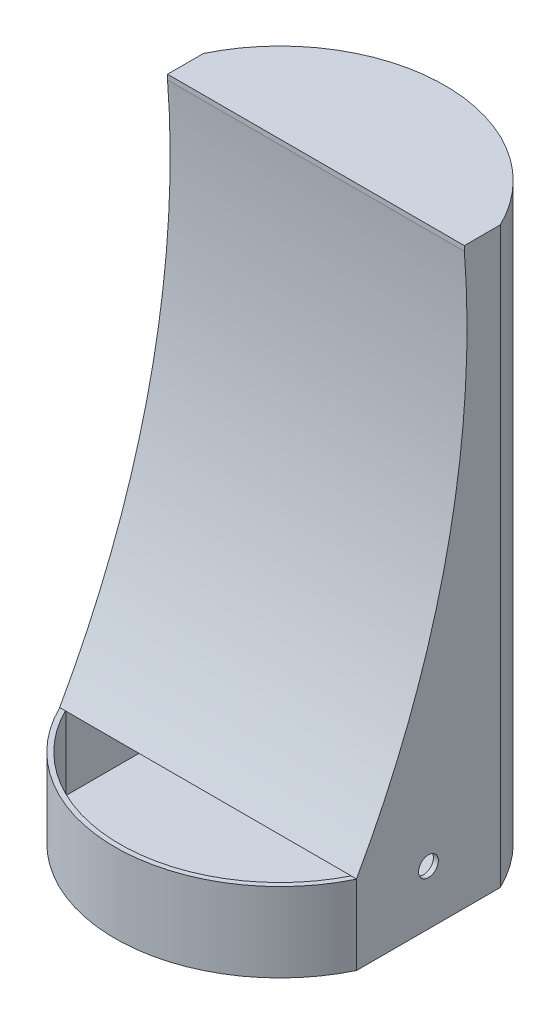
from build123d import *

# Parameters (mm, degrees)
SKETCH1_R            = 100
BOSS_EXTRUDE2_DEPTH  = 3
SKETCH5_W            = 3
SKETCH5_H            = 87
BOSS_EXTRUDE5_DEPTH  = 45
SKETCH8_W            = 3
SKETCH8_H            = 87
BOSS_EXTRUDE6_DEPTH  = 45
SKETCH9_W            = 23.719660605
SKETCH9_H            = 94.301811056
CUT_EXTRUDE2_DEPTH   = 45
SKETCH10_W           = 23.969699351
SKETCH10_H           = 92.447375273
CUT_EXTRUDE3_DEPTH   = 45
SKETCH11_R           = 6
CUT_EXTRUDE4_DEPTH   = 45
CUT_EXTRUDE5_START   = -45
SKETCH12_R           = 6
CUT_EXTRUDE5_DEPTH   = 45
BOSS_EXTRUDE7_DEPTH  = 45
CUT_EXTRUDE6_DEPTH   = 45
BOSS_EXTRUDE8_DEPTH  = 3
BOSS_EXTRUDE10_DEPTH = 3
SWEEP1_START         = 48
SWEEP1_DEPTH         = 300
BOSS_EXTRUDE11_START = -3
BOSS_EXTRUDE11_DEPTH = 3
SWEEP2_START         = -90
SWEEP2_DEPTH         = 180


# Read off the part's stored shape, not the designer's step: Sweep1, Sweep2
with BuildPart() as part:
    # Sketch1 → Boss-Extrude2 (new body)
    with BuildSketch(Plane(origin=(0, 0, 0), x_dir=(1, 0, 0), z_dir=(0, 1, 0))):
        with Locations(Location((0, 0, 0), (0, 0, 270))):
            Circle(SKETCH1_R)
    extrude(amount=BOSS_EXTRUDE2_DEPTH)

    # Sketch5 → Boss-Extrude5 (add)
    with BuildSketch(Plane(origin=(0, 3, 0), x_dir=(1, 0, 0), z_dir=(0, 1, 0))):
        with Locations((88.5, 0.088989435)):
            Rectangle(SKETCH5_W, SKETCH5_H)
    extrude(amount=BOSS_EXTRUDE5_DEPTH)

    # Sketch8 → Boss-Extrude6 (add)
    with BuildSketch(Plane(origin=(0, 3, 0), x_dir=(1, 0, 0), z_dir=(0, 1, 0))):
        with Locations((-88.5, 0.088989435)):
            Rectangle(SKETCH8_W, SKETCH8_H)
    extrude(amount=BOSS_EXTRUDE6_DEPTH)

    # Sketch9 → Cut-Extrude2 (cut)
    with BuildSketch(Plane(origin=(0, 3, 0), x_dir=(1, 0, 0), z_dir=(0, 1, 0))):
        with Locations((101.859830303, -3.561916093)):
            Rectangle(SKETCH9_W, SKETCH9_H)
    extrude(amount=-CUT_EXTRUDE2_DEPTH, mode=Mode.SUBTRACT)

    # Sketch10 → Cut-Extrude3 (cut)
    with BuildSketch(Plane(origin=(0, 3, 0), x_dir=(1, 0, 0), z_dir=(0, 1, 0))):
        with Locations((-101.984849676, 2.812677071)):
            Rectangle(SKETCH10_W, SKETCH10_H)
    extrude(amount=-CUT_EXTRUDE3_DEPTH, mode=Mode.SUBTRACT)

    # Sketch11 → Cut-Extrude4 (cut)
    with BuildSketch(Plane.ZY.offset(90)):
        with Locations((0, 33)):
            Circle(SKETCH11_R)
    extrude(amount=-CUT_EXTRUDE4_DEPTH, mode=Mode.SUBTRACT)

    # Sketch12 → Cut-Extrude5 (cut)
    with BuildSketch(Plane(origin=(90, 0, 0), x_dir=(0, 0, -1), z_dir=(1, 0, 0)).offset(CUT_EXTRUDE5_START)):
        with Locations(Location((0, 33, 0), (0, 0, 180))):
            Circle(SKETCH12_R)
    extrude(amount=CUT_EXTRUDE5_DEPTH, mode=Mode.SUBTRACT)

    # Sketch14 → Boss-Extrude7 (add)
    with BuildSketch(Plane(origin=(0, 3, 0), x_dir=(1, 0, 0), z_dir=(0, 1, 0))):
        with BuildLine():
            Line((-90, -43.411010565), (-90.085982049, -43.411010565))
            ThreePointArc((-90.085982049, -43.411010565), (-0.098829893, -99.999951163), (90, -43.588989435))
            Line((90, -43.588989435), (90, -43.411010565))
            Line((90, -43.411010565), (87, -43.411010565))
            Line((87, -43.411010565), (87, 43.588989435))
            Line((87, 43.588989435), (90, 43.588989435))
            ThreePointArc((90, 43.588989435), (0, 100), (-90, 43.588989435))
            Line((-90, 43.588989435), (-87, 43.588989435))
            Line((-87, 43.588989435), (-87, -43.411010565))
            Line((-87, -43.411010565), (-90, -43.411010565))
        make_face()
    extrude(amount=BOSS_EXTRUDE7_DEPTH)

    # 3DSketch1 → Cut-Extrude6 (cut)
    with BuildSketch(Plane(origin=(-87, 48, -42.895221179), x_dir=(0.8969072164948455, 0, 0.4422187750417981), z_dir=(0, -1, 0))):
        with BuildLine():
            Line((0, 0), (37.93814433, 76.946066857))
            ThreePointArc((37.93814433, 76.946066857), (139.895221179, 87), (194, 0))
            Line((194, 0), (156.06185567, -76.946066857))
            ThreePointArc((156.06185567, -76.946066857), (54.104778821, -87), (0, 0))
        make_face()
    extrude(amount=CUT_EXTRUDE6_DEPTH, mode=Mode.SUBTRACT)

    # Sketch17 → Boss-Extrude8 (add)
    with BuildSketch(Plane(origin=(90, 0, 0), x_dir=(0, 0, -1), z_dir=(1, 0, 0))):
        with BuildLine():
            Line((21.794494718, 348), (43.588989435, 348))
            Line((43.588989435, 348), (43.588989435, 48))
            Line((43.588989435, 48), (-43.588989435, 48))
            ThreePointArc((-43.588989435, 48), (11.635050375, 193.089199561), (21.794494718, 348))
        make_face()
    extrude(amount=-BOSS_EXTRUDE8_DEPTH)

    # Sketch21 → Boss-Extrude10 (add)
    with BuildSketch(Plane.ZY.offset(90)):
        with BuildLine():
            Line((43.411010565, 48), (-43.588989435, 48))
            Line((-43.588989435, 48), (-43.588989435, 348))
            Line((-43.588989435, 348), (-21.794494718, 348))
            ThreePointArc((-21.794494718, 348), (-11.721133915, 193.103198738), (43.411010565, 48))
        make_face()
    extrude(amount=-BOSS_EXTRUDE10_DEPTH)

    # Sweep1 outline → Sweep1 (add)
    with BuildSketch(Plane(origin=(0, 0, 0), x_dir=(1, 0, 0), z_dir=(0, 1, 0)).offset(SWEEP1_START)):
        with BuildLine():
            ThreePointArc((90, 43.588989435), (0, 100), (-90, 43.588989435))
            Line((-90, 43.588989435), (-87, 43.588989435))
            ThreePointArc((-87, 43.588989435), (0, 97.308786859), (87, 43.588989435))
            Line((87, 43.588989435), (90, 43.588989435))
        make_face()
    extrude(amount=SWEEP1_DEPTH)

    # Sketch26 → Boss-Extrude11 (add)
    with BuildSketch(Plane(origin=(0, 348, 0), x_dir=(1, 0, 0), z_dir=(0, 1, 0)).offset(BOSS_EXTRUDE11_START)):
        with BuildLine():
            Line((-90, 21.794494718), (90, 21.794494718))
            Line((90, 21.794494718), (90, 43.588989435))
            ThreePointArc((90, 43.588989435), (0, 100), (-90, 43.588989435))
            Line((-90, 43.588989435), (-90, 21.794494718))
        make_face()
    extrude(amount=BOSS_EXTRUDE11_DEPTH)

    # Sweep2 outline → Sweep2 (add)
    with BuildSketch(Plane.YZ.offset(SWEEP2_START)):
        with BuildLine():
            ThreePointArc((50.627921058, 41.94345394), (193.103198738, -11.721133915), (345, -22.038813222))
            Line((345, -22.038813222), (345, -21.794494718))
            ThreePointArc((345, -21.794494718), (191.70412896, -11.165627984), (48.136044185, 43.613947774))
            Line((48.136044185, 43.613947774), (50.627921058, 41.94345394))
        make_face()
    extrude(amount=SWEEP2_DEPTH)


solid = part.part
